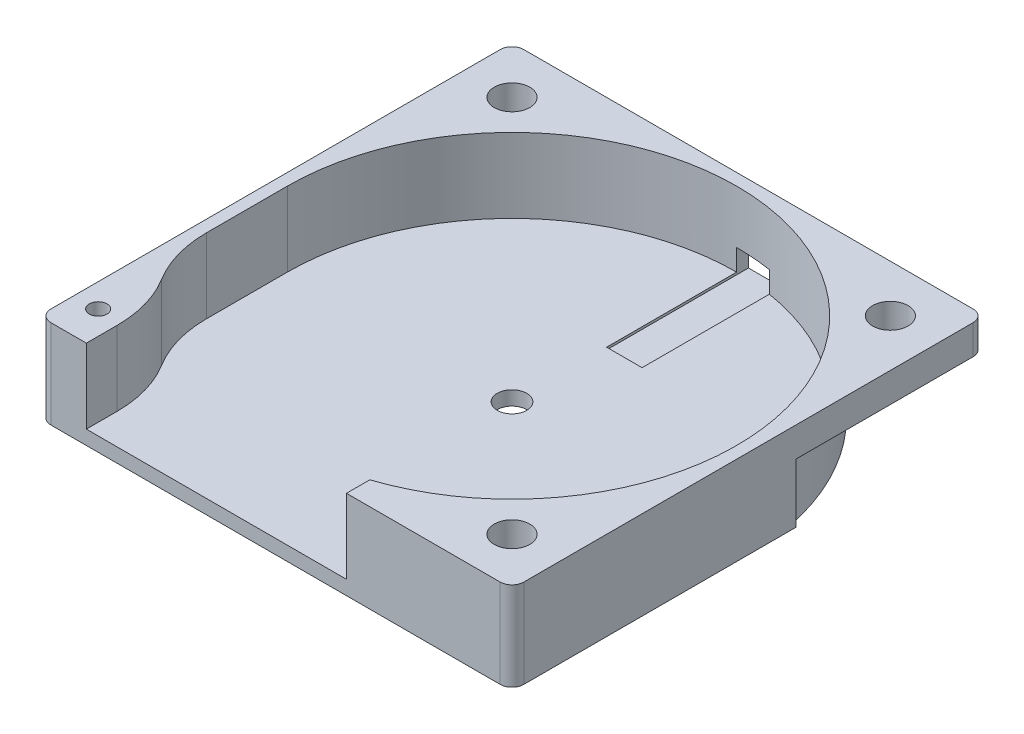
from build123d import *

# Parameters (mm, degrees)
SKETCH1_W               = 40
SKETCH1_H               = 40
BOSS_EXTRUDE1_DEPTH     = 7.5
SKETCH2_R               = 19
CUT_EXTRUDE1_DEPTH      = 6.3
SKETCH3_W               = 25
SKETCH3_H               = 20
CUT_EXTRUDE2_DEPTH      = 6.3
SKETCH4_R               = 1.5
CUT_EXTRUDE3_DEPTH      = 30.261749777
SKETCH6_R               = 1.25
CUT_EXTRUDE5_DEPTH      = 29.977404991
SKETCH7_W               = 3
SKETCH7_H               = 6
BOSS_EXTRUDE2_DEPTH     = 6.3
FILLET1_R               = 10
FILLET2_R               = 10
SKETCH8_R               = 0.75
CUT_EXTRUDE6_DEPTH      = 30.261749777
BOSS_EXTRUDE3_DEPTH     = 5
FILLET3_R               = 1
CUT_EXTRUDE7_START      = -1
SKETCH10_W              = 3
SKETCH10_H              = 12
CUT_EXTRUDE7_DEPTH      = 2
CUT_EXTRUDE8_DEPTH      = 33.882366095
CUT_EXTRUDE8_DEPTH_BACK = 33.882366095
SKETCH11_W              = 5
SKETCH11_H              = 7.5
CUT_EXTRUDE9_START      = -5
SKETCH12_R              = 1.5
CUT_EXTRUDE9_DEPTH      = 5


with BuildPart() as part:
    # Sketch1 → Boss-Extrude1 (new body)
    with BuildSketch(Plane(origin=(0, 0, 0), x_dir=(1, 0, 0), z_dir=(0, 1, 0))):
        Rectangle(SKETCH1_W, SKETCH1_H)
    extrude(amount=BOSS_EXTRUDE1_DEPTH)

    # Sketch2 → Cut-Extrude1 (cut)
    with BuildSketch(Plane(origin=(0, 7.5, 0), x_dir=(1, 0, 0), z_dir=(0, 1, 0))):
        with Locations(Location((0, 0, 0), (0, 0, 270))):
            Circle(SKETCH2_R)
    extrude(amount=-CUT_EXTRUDE1_DEPTH, mode=Mode.SUBTRACT)

    # Sketch3 → Cut-Extrude2 (cut)
    with BuildSketch(Plane(origin=(0, 7.5, 0), x_dir=(1, 0, 0), z_dir=(0, 1, 0))):
        with Locations((-6.5, -10)):
            Rectangle(SKETCH3_W, SKETCH3_H)
    extrude(amount=-CUT_EXTRUDE2_DEPTH, mode=Mode.SUBTRACT)

    # Sketch4 → Cut-Extrude3 (cut, through all)
    with BuildSketch(Plane(origin=(0, 7.5, 0), x_dir=(1, 0, 0), z_dir=(0, 1, 0))):
        with Locations(Location((-16, 16, 0), (0, 0, 270))):
            Circle(SKETCH4_R)
        with Locations(Location((16, 16, 0), (0, 0, 270))):
            Circle(SKETCH4_R)
        with Locations(Location((16, -16, 0), (0, 0, 270))):
            Circle(SKETCH4_R)
    extrude(amount=-CUT_EXTRUDE3_DEPTH, mode=Mode.SUBTRACT)

    # Sketch6 → Cut-Extrude5 (cut, through all)
    with BuildSketch(Plane(origin=(0, 1.2, 0), x_dir=(1, 0, 0), z_dir=(0, 1, 0))):
        with Locations(Location((0, 0, 0), (0, 0, 270))):
            Circle(SKETCH6_R)
    extrude(amount=-CUT_EXTRUDE5_DEPTH, mode=Mode.SUBTRACT)

    # Sketch7 → Boss-Extrude2 (add)
    with BuildSketch(Plane(origin=(0, 1.2, 0), x_dir=(1, 0, 0), z_dir=(0, 1, 0))):
        with Locations((-17.5, -17)):
            Rectangle(SKETCH7_W, SKETCH7_H)
    extrude(amount=BOSS_EXTRUDE2_DEPTH)

    # Fillet1
    # the kernel refuses this fillet: 10 mm, written as the material it adds along each edge
    with BuildSketch(Plane(origin=(-19, 1.2, 14), x_dir=(0, 0, -1), z_dir=(0, 1, 0))) as fillet1_piece_1:
        with BuildLine():
            CenterArc((7.141428429, -10), FILLET1_R, 90, 45.572995999)
            Line((0, -3), (-0.142828569, -2.86))
            ThreePointArc((-0.142828569, -2.86), (-0.2, -1.5), (-0.2, 0))
            Line((-0.2, 0), (0, 0.2))
            Line((0, 0.2), (7.141428429, 0.2))
            Line((7.141428429, 0.2), (7.141428429, 0))
        make_face()
    extrude(amount=6.3)

    # Fillet2
    fillet2_edges = [part.edges().sort_by_distance(p)[0] for p in [
        (-16, 4.35, 14),
    ]]
    fillet(fillet2_edges, radius=FILLET2_R)

    # Sketch8 → Cut-Extrude6 (cut, through all)
    with BuildSketch(Plane(origin=(0, 7.5, 0), x_dir=(1, 0, 0), z_dir=(0, 1, 0))):
        with Locations(Location((-18, -17, 0), (0, 0, 270))):
            Circle(SKETCH8_R)
    extrude(amount=-CUT_EXTRUDE6_DEPTH, mode=Mode.SUBTRACT)

    # Sketch9 → Boss-Extrude3 (add)
    with BuildSketch(Plane.XY.offset(20)):
        Polygon((-18, 7.5), (-16, 7.5), (-16, 1.2), (6, 1.2), (6, 7.5), (8, 7.5), (8, 0), (-18, 0), align=None)
    extrude(amount=BOSS_EXTRUDE3_DEPTH)

    # Fillet3
    fillet3_edges = [part.edges().sort_by_distance(p)[0] for p in [
        (20, 3.75, 20),
        (-20, 3.75, 20),
        (-20, 3.75, -20),
        (20, 3.75, -20),
    ]]
    fillet(fillet3_edges, radius=FILLET3_R)

    # Sketch10 → Cut-Extrude7 (cut)
    with BuildSketch(Plane.XZ.offset(CUT_EXTRUDE7_START)):
        with Locations((1.5, -14)):
            Rectangle(SKETCH10_W, SKETCH10_H)
    extrude(amount=-CUT_EXTRUDE7_DEPTH, mode=Mode.SUBTRACT)

    # Sketch11 → Cut-Extrude8 (cut, two sides: drawn at the far end of the back side and taken through both)
    with BuildSketch(Plane(origin=(0, 0, 0), x_dir=(0, 0, -1), z_dir=(1, 0, 0)).offset(-CUT_EXTRUDE8_DEPTH_BACK)):
        with Locations((-22.5, 3.75)):
            Rectangle(SKETCH11_W, SKETCH11_H)
    extrude(amount=CUT_EXTRUDE8_DEPTH + CUT_EXTRUDE8_DEPTH_BACK, mode=Mode.SUBTRACT)

    # Sketch12 → Cut-Extrude9 (cut)
    # profile 1 of 2: a face of its own
    with BuildSketch(Plane.XZ.offset(CUT_EXTRUDE9_START)):
        with BuildLine():
            Line((20, -4), (19.595917942, -4))
            ThreePointArc((19.595917942, -4), (14.142135624, -14.142135624), (4, -19.595917942))
            Line((4, -19.595917942), (4, -20))
            Line((4, -20), (19, -20))
            ThreePointArc((19, -20), (19.707106781, -19.707106781), (20, -19))
            Line((20, -19), (20, -4))
        make_face()
        with Locations(Location((16, -16, 0), (0, 0, 90))):
            Circle(SKETCH12_R, mode=Mode.SUBTRACT)
    # profile 2 of 2: a face of its own
    with BuildSketch(Plane.XZ.offset(CUT_EXTRUDE9_START)):
        with BuildLine():
            Line((-4, -20), (-4, -19.595917942))
            ThreePointArc((-4, -19.595917942), (-14.142135624, -14.142135624), (-19.595917942, -4))
            Line((-19.595917942, -4), (-20, -4))
            Line((-20, -4), (-20, -19))
            ThreePointArc((-20, -19), (-19.707106781, -19.707106781), (-19, -20))
            Line((-19, -20), (-4, -20))
        make_face()
        with Locations(Location((-16, -16, 0), (0, 0, 90))):
            Circle(SKETCH12_R, mode=Mode.SUBTRACT)
    extrude(amount=CUT_EXTRUDE9_DEPTH, mode=Mode.SUBTRACT)


solid = part.part
